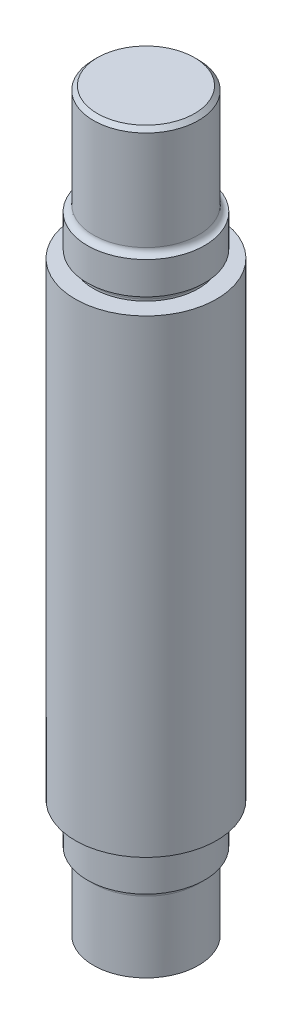
from build123d import *

# Parameters (mm, degrees)
CHAMFER1_SIZE = 1.7
FILLET4_R     = 2.6
FILLET7_R     = 2.6
FILLET8_R     = 2.6
FILLET9_R     = 2.6


with BuildPart() as part:
    # Sketch1 → Revolve3 (revolve)
    with BuildSketch(Plane.XY):
        Polygon((-22.55, 98.726264023), (-0.15, 98.726264023), (-0.15, -215.073735977), (-22.55, -215.073735977), (-22.55, -182.273735977), (-25.15, -182.273735977), (-25.15, -168.473735977), (-22.55, -168.473735977), (-22.55, -165.073735977), (-30.3, -165.073735977), (-30.3, 34.926264023), (-22.55, 34.926264023), (-22.55, 38.326264023), (-25.15, 38.326264023), (-25.15, 52.126264023), (-22.55, 52.126264023), align=None)
    revolve(axis=Axis((-0.15, 98.726264023, 0), (0, -1, 0)))

    # Chamfer1
    chamfer1_edges = [part.edges().sort_by_distance(p)[0] for p in [
        (22.25, 98.726264023, 0),
    ]]
    chamfer(chamfer1_edges, length=CHAMFER1_SIZE)

    # Fillet4
    fillet4_edges = [part.edges().sort_by_distance(p)[0] for p in [
        (22.25, 52.126264023, 0),
    ]]
    fillet(fillet4_edges, radius=FILLET4_R - 0.0001)  # a hair under: the kernel refuses the full size

    # Fillet7
    fillet7_edges = [part.edges().sort_by_distance(p)[0] for p in [
        (22.25, 38.326264023, 0),
    ]]
    fillet(fillet7_edges, radius=FILLET7_R - 0.0001)  # a hair under: the kernel refuses the full size

    # Fillet8
    fillet8_edges = [part.edges().sort_by_distance(p)[0] for p in [
        (22.25, -182.273735977, 0),
    ]]
    fillet(fillet8_edges, radius=FILLET8_R - 0.0001)  # a hair under: the kernel refuses the full size

    # Fillet9
    fillet9_edges = [part.edges().sort_by_distance(p)[0] for p in [
        (22.25, -168.473735977, 0),
    ]]
    fillet(fillet9_edges, radius=FILLET9_R - 0.0001)  # a hair under: the kernel refuses the full size


solid = part.part
